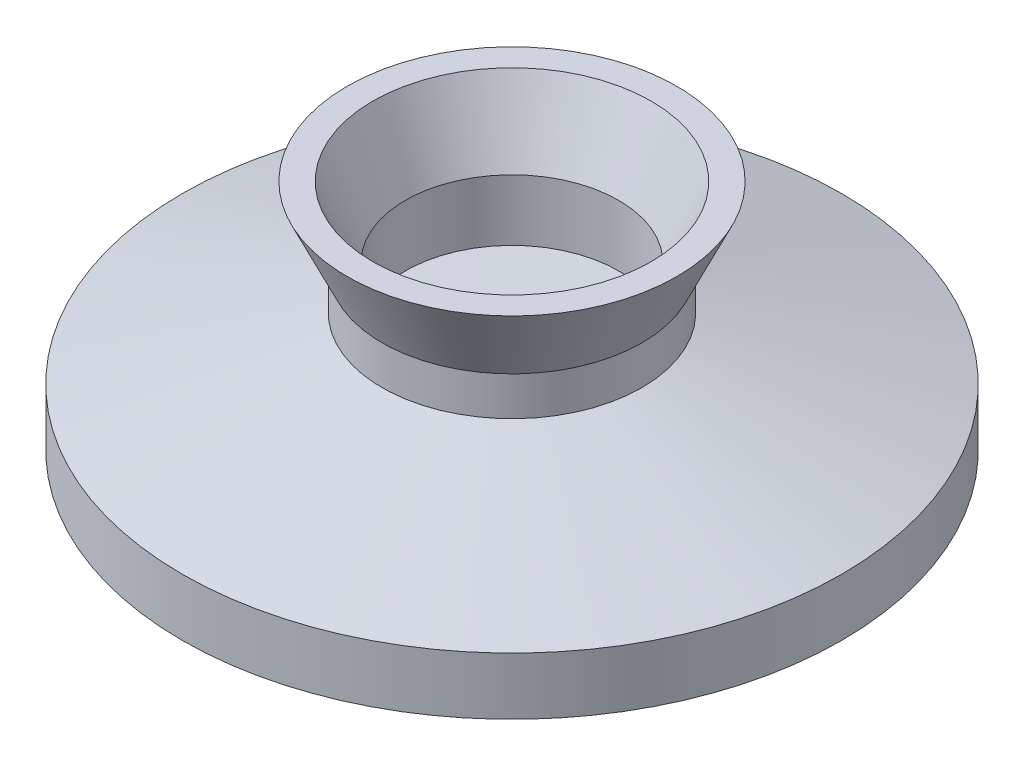
from build123d import *


with BuildPart() as part:
    # Sketch1 → Revolve2 (revolve)
    with BuildSketch(Plane.XY):
        Polygon((78.47179939, -15.749118059), (4.2164, -20.290772846), (4.2164, -26.273427127), (85, -26.273427127), (85, -11.486309355), (33.5, 4.426010589), (33.5, 14.426010589), (42.5, 33.726572873), (35.879732486, 33.726572873), (27.5, 15.756178565), (27.5, 0), align=None)
    revolve(axis=Axis((1e-09, -1021.213113582, 0), (0, 1, 0)))


solid = part.part
